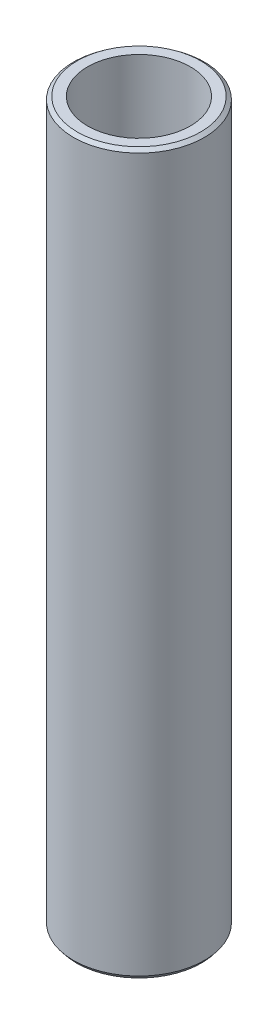
from build123d import *
from OCP.BRepFilletAPI import BRepFilletAPI_MakeChamfer

# Parameters (mm, degrees)
SKETCH1_R           = 37.5
BOSS_EXTRUDE1_DEPTH = 412.26381985
SKETCH2_R           = 29.440052059
CUT_EXTRUDE1_DEPTH  = 416.660867965
CHAMFER1_SIZE       = 1.649397483
CHAMFER1_SIZE2      = 2.134035557


with BuildPart() as part:
    # Sketch1 → Boss-Extrude1 (new body)
    with BuildSketch(Plane(origin=(0, 0, 0), x_dir=(1, 0, 0), z_dir=(0, 1, 0))):
        Circle(SKETCH1_R)
    extrude(amount=BOSS_EXTRUDE1_DEPTH)

    # Sketch2 → Cut-Extrude1 (cut, through all)
    with BuildSketch(Plane(origin=(0, 0, 0), x_dir=(1, 0, 0), z_dir=(0, 1, 0))):
        Circle(SKETCH2_R)
    extrude(amount=CUT_EXTRUDE1_DEPTH, mode=Mode.SUBTRACT)

    # Chamfer1: one chamfer whose edges measure the first distance from different faces: ONE call of the kernel's chamfer builder (chamfer() names one face for all edges)
    chamfer1_edges_1 = [part.edges().sort_by_distance(p)[0] for p in [
        (-37.5, 412.26381985, 0),
    ]]
    chamfer1_side_1 = [part.faces().sort_by_distance(p)[0] for p in [
        (-37.5, 206.131909925, 0),
    ]]
    chamfer1_edges_2 = [part.edges().sort_by_distance(p)[0] for p in [
        (-37.5, 0, 0),
    ]]
    chamfer1_side_2 = [part.faces().sort_by_distance(p)[0] for p in [
        (-36.439339828, 0, 0),
    ]]
    chamfer1 = BRepFilletAPI_MakeChamfer(part.part.solid().wrapped)
    for e in chamfer1_edges_1:
        chamfer1.Add(CHAMFER1_SIZE, CHAMFER1_SIZE2, e.wrapped, chamfer1_side_1[0].wrapped)  # the first distance lies on this face
    for e in chamfer1_edges_2:
        chamfer1.Add(CHAMFER1_SIZE, CHAMFER1_SIZE2, e.wrapped, chamfer1_side_2[0].wrapped)  # the first distance lies on this face
    add(Compound.cast(chamfer1.Shape()), mode=Mode.REPLACE)


solid = part.part
